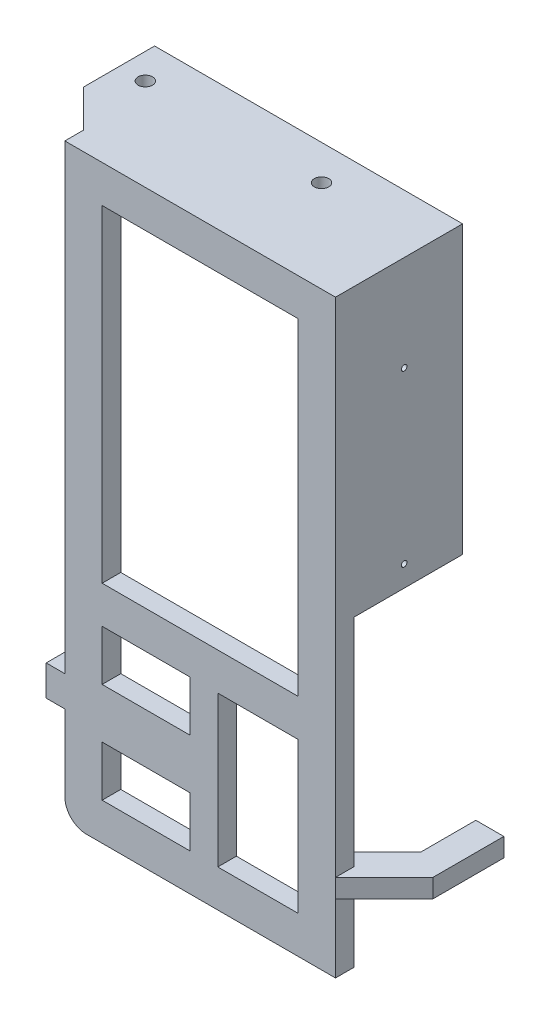
from build123d import *

# Parameters (mm, degrees)
SKETCH_2_W          = 6.55
SKETCH_2_H          = 6.55
SKETCH_2_R          = 1.32
EXTRUDE_2_DEPTH     = 4
SKETCH_4_W          = 23.255
SKETCH_4_H          = 57.4134
SKETCH_4_R          = 0.6
EXTRUDE_5_DEPTH     = 4
SKETCH_5_W          = 66.05
SKETCH_5_H          = 23.255
SKETCH_5_R          = 1.55
EXTRUDE_6_DEPTH     = 4
SKETCH_7_W          = 66.05
SKETCH_7_H          = 126.45
EXTRUDE_8_DEPTH     = 4
SKETCH_11_W         = 17.25
SKETCH_11_H         = 32.3
SKETCH_11_W_2       = 42.05
SKETCH_11_H_2       = 70.15
SKETCH_11_W_3       = 18.8
SKETCH_11_H_3       = 10.8
CUT_EXTRUDE_3_DEPTH = 125.085535116
EXTRUDE_9_DEPTH     = 4
CUT_EXTRUDE_4_DEPTH = 10


with BuildPart() as part:
    # 草图2 → 凸台-拉伸2 (new body)
    with BuildSketch(Plane.ZY.offset(16.4)):
        with Locations((-3.275, 12.325)):
            Rectangle(SKETCH_2_W, SKETCH_2_H)
        with Locations((-3.275, 12.325)):
            Circle(SKETCH_2_R, mode=Mode.SUBTRACT)
    extrude(amount=EXTRUDE_2_DEPTH)



with BuildPart() as body_2:
    # 草图4 → 凸台-拉伸5 (new body)
    with BuildSketch(Plane(origin=(37.65, 0, 0), x_dir=(0, 0, -1), z_dir=(1, 0, 0))):
        with Locations((11.6275, 81.8433)):
            Rectangle(SKETCH_4_W, SKETCH_4_H)
        with Locations((10.735, 94.05)):
            Circle(SKETCH_4_R, mode=Mode.SUBTRACT)
        with Locations((10.735, 57.65)):
            Circle(SKETCH_4_R, mode=Mode.SUBTRACT)
    extrude(amount=EXTRUDE_5_DEPTH)

    # 草图5 → 凸台-拉伸6 (add)
    with BuildSketch(Plane(origin=(0, 110.55, 0), x_dir=(1, 0, 0), z_dir=(0, 1, 0))):
        with Locations((8.625, 11.6275)):
            Rectangle(SKETCH_5_W, SKETCH_5_H)
        with Locations((-18.9, 15.755)):
            Circle(SKETCH_5_R, mode=Mode.SUBTRACT)
        with Locations((18.9, 15.755)):
            Circle(SKETCH_5_R, mode=Mode.SUBTRACT)
    extrude(amount=EXTRUDE_6_DEPTH)


with BuildPart() as part_1:
    add(part.part)

    add(body_2.part)  # 凸台-拉伸8 merges body 2
    # 草图7 → 凸台-拉伸8 (add)
    with BuildSketch(Plane.XY):
        with Locations((8.625, 51.325)):
            Rectangle(SKETCH_7_W, SKETCH_7_H)
    extrude(amount=EXTRUDE_8_DEPTH)

    # 草图11 → 切除-拉伸3 (cut, through all)
    with BuildSketch(Plane(origin=(0, 0, 0), x_dir=(-1, 0, 0), z_dir=(0, 0, -1))):
        with Locations((-25.025, 12.25)):
            Rectangle(SKETCH_11_W, SKETCH_11_H)
        with Locations((-12.625, 71.475)):
            Rectangle(SKETCH_11_W_2, SKETCH_11_H_2)
        with Locations((-1, 1.5)):
            Rectangle(SKETCH_11_W_3, SKETCH_11_H_3)
        with Locations((-1, 23)):
            Rectangle(SKETCH_11_W_3, SKETCH_11_H_3)
        with BuildLine():
            ThreePointArc((16.4, -7.25), (15.038046533, -10.538046533), (11.75, -11.9))
            Line((11.75, -11.9), (24.4, -11.9))
            Line((24.4, -11.9), (24.4, 106.55))
            Line((24.4, 106.55), (16.4, 106.55))
            Line((16.4, 106.55), (16.4, 15.6))
            Line((16.4, 15.6), (20.4, 15.6))
            Line((20.4, 15.6), (20.4, 9.05))
            Line((20.4, 9.05), (16.4, 9.05))
            Line((16.4, 9.05), (16.4, -7.25))
        make_face()
    extrude(amount=-CUT_EXTRUDE_3_DEPTH, mode=Mode.SUBTRACT)

    # 草图12 → 凸台-拉伸9 (add)
    with BuildSketch(Plane(origin=(0, 2.790336251, 0), x_dir=(1, 0, 0), z_dir=(0, 1, 0))):
        Polygon((52.095757056, 21.655), (46.095757056, 21.655), (46.095757056, 9.855), (36.240757056, 0), (41.65, -4), (52.095757056, 6.445757056), align=None)
    extrude(amount=EXTRUDE_9_DEPTH)

    # 草图13 → 切除-拉伸4 (cut, symmetric)
    with BuildSketch(Plane.XZ.offset(-110.55)):
        Polygon((-24.4, -8), (-16.4, 0), (-16.4, 4), (-24.4, 4), align=None)
    extrude(amount=CUT_EXTRUDE_4_DEPTH, both=True, mode=Mode.SUBTRACT)


solid = part_1.part
